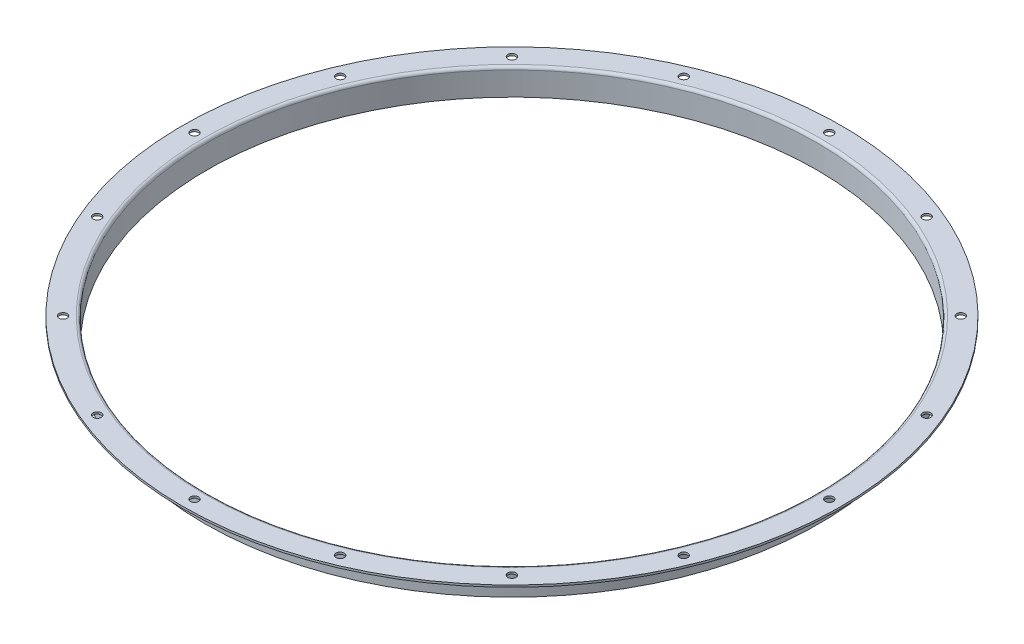
from build123d import *

# Parameters (mm, degrees)
SKETCH1_R          = 406.5
SKETCH1_R_2        = 376.5
BASE_FLANGE1_DEPTH = 2.5
SKETCH8_R          = 5
CUT_EXTRUDE1_DEPTH = 10


# Read off the part's stored shape, not the designer's step: Edge-Flange1
# Sheet-metal steps are written as plain solids
with BuildPart() as part:
    # Sketch1 → Base-Flange1 (new body)
    with BuildSketch(Plane(origin=(0, 0, 0), x_dir=(1, 0, 0), z_dir=(0, 1, 0))):
        with Locations(Location((0, 0, 0), (0, 0, 270))):
            Circle(SKETCH1_R)
        with Locations(Location((0, 0, 0), (0, 0, 270))):
            Circle(SKETCH1_R_2, mode=Mode.SUBTRACT)
    extrude(amount=-BASE_FLANGE1_DEPTH)

    # Edge-Flange1 outline → Edge-Flange1 (revolve, cut)
    with BuildSketch(Plane.XY):
        with BuildLine():
            Line((376.5, -2.5), (376.645898034, -2.5))
            ThreePointArc((376.645898034, -2.5), (377.908349934, -0.69375696), (380, 0))
            Line((380, 0), (376.5, 0))
            Line((376.5, 0), (376.5, -2.5))
        make_face()
    revolve(axis=Axis((0, 0, 0), (0, 1, 0)), mode=Mode.SUBTRACT)

    # Edge-Flange1 2 outline → Edge-Flange1 2 (revolve)
    with BuildSketch(Plane.XY):
        with BuildLine():
            Line((376.5, -3.5), (376.5, -32.5))
            Line((376.5, -32.5), (379, -32.5))
            Line((379, -32.5), (379, -3.5))
            ThreePointArc((379, -3.5), (379.292893219, -2.792893219), (380, -2.5))
            Line((380, -2.5), (376.645898034, -2.5))
            ThreePointArc((376.645898034, -2.5), (376.536666571, -2.994706462), (376.5, -3.5))
        make_face()
    revolve(axis=Axis((0, 0, 0), (0, 1, 0)))

    # Sketch8 → Cut-Extrude1 (cut)
    with BuildSketch(Plane(origin=(0, 0, 0), x_dir=(1, 0, 0), z_dir=(0, 1, 0))):
        with Locations(Location((149.820563771, 361.698836978, 0), (0, 0, 270))):
            Circle(SKETCH8_R)
        with Locations(Location((276.832304835, 276.832304835, 0), (0, 0, 270))):
            Circle(SKETCH8_R)
        with Locations(Location((0, 391.5, 0), (0, 0, 270))):
            Circle(SKETCH8_R)
        with Locations(Location((361.698836978, 149.820563771, 0), (0, 0, 270))):
            Circle(SKETCH8_R)
        with Locations(Location((391.5, 0, 0), (0, 0, 270))):
            Circle(SKETCH8_R)
        with Locations(Location((361.698836978, -149.820563771, 0), (0, 0, 270))):
            Circle(SKETCH8_R)
        with Locations(Location((276.832304835, -276.832304835, 0), (0, 0, 270))):
            Circle(SKETCH8_R)
        with Locations(Location((149.820563771, -361.698836978, 0), (0, 0, 270))):
            Circle(SKETCH8_R)
        with Locations(Location((0, -391.5, 0), (0, 0, 270))):
            Circle(SKETCH8_R)
        with Locations(Location((-149.820563771, -361.698836978, 0), (0, 0, 270))):
            Circle(SKETCH8_R)
        with Locations(Location((-276.832304834, -276.832304835, 0), (0, 0, 270))):
            Circle(SKETCH8_R)
        with Locations(Location((-361.698836978, -149.820563771, 0), (0, 0, 270))):
            Circle(SKETCH8_R)
        with Locations(Location((-391.5, 0, 0), (0, 0, 270))):
            Circle(SKETCH8_R)
        with Locations(Location((-361.698836978, 149.820563771, 0), (0, 0, 270))):
            Circle(SKETCH8_R)
        with Locations(Location((-276.832304835, 276.832304835, 0), (0, 0, 270))):
            Circle(SKETCH8_R)
        with Locations(Location((-149.820563771, 361.698836978, 0), (0, 0, 270))):
            Circle(SKETCH8_R)
    extrude(amount=-CUT_EXTRUDE1_DEPTH, mode=Mode.SUBTRACT)


solid = part.part
